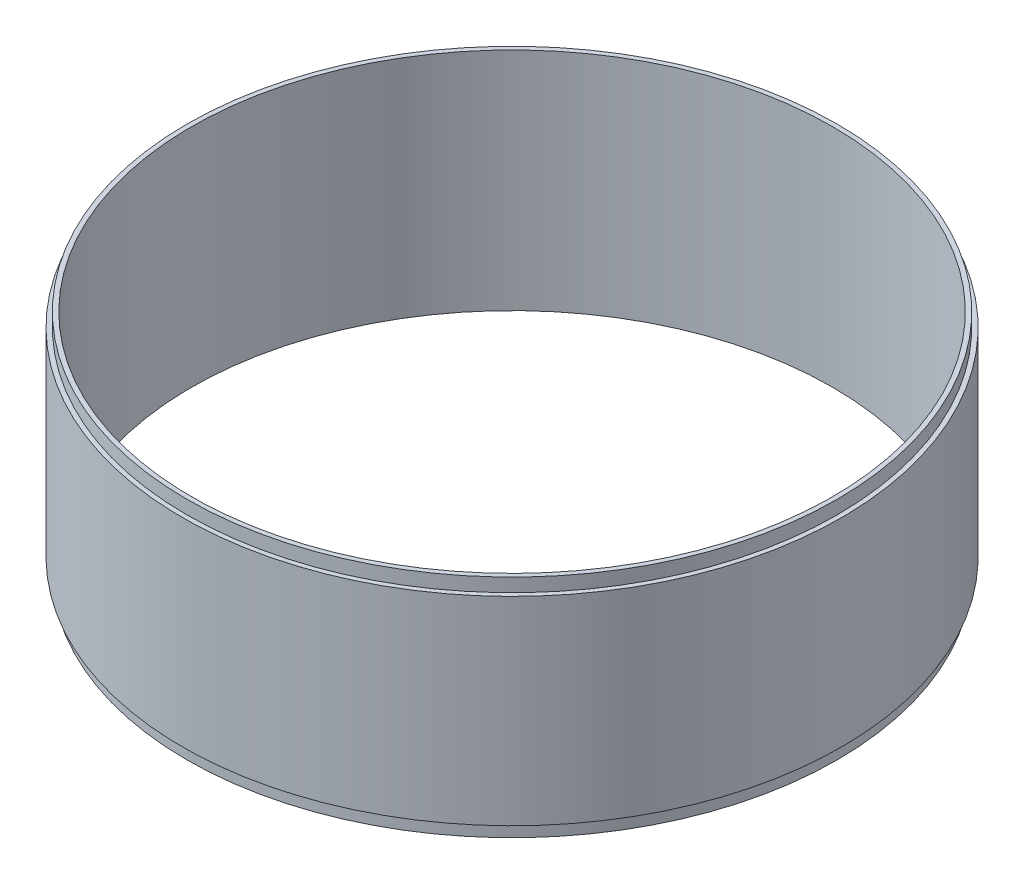
from build123d import *


with BuildPart() as part:
    # Schizzo1 → Rivoluzione1 (revolve)
    with BuildSketch(Plane.XY):
        Polygon((-71, 0), (-71, 3), (-71, 50), (-72, 50), (-72, 47), (-73, 47), (-73, 3), (-72, 3), (-72, 0), align=None)
    revolve(axis=Axis((0, 0, 0), (0, 1, 0)))


solid = part.part
